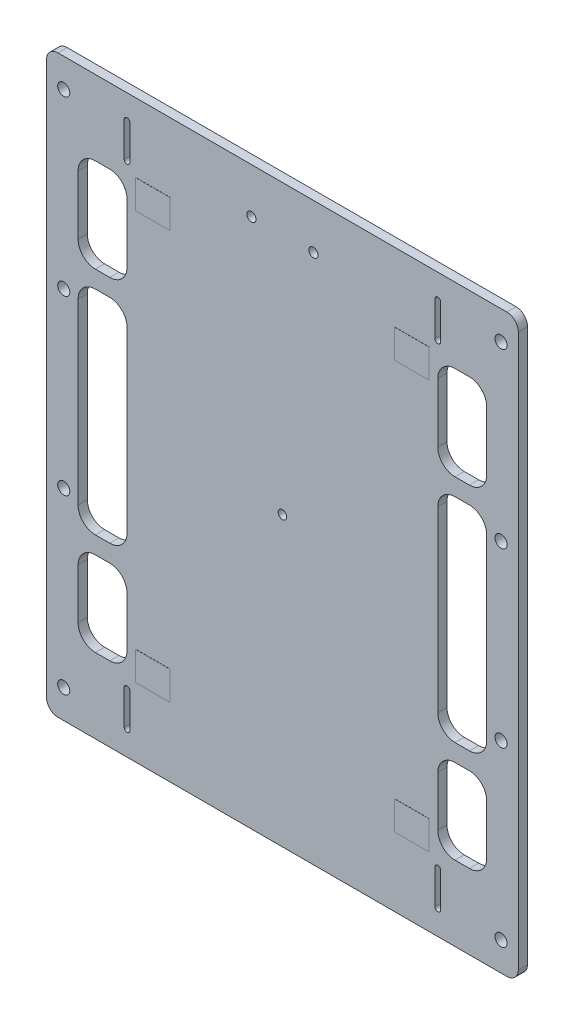
from build123d import *

# Parameters (mm, degrees)
BOARDOUTLINE_DEPTH          = 1.6
SKETCH2_R                   = 0.75
SKETCH2_R_2                 = 0.8
COMPONENTHOLES_DEPTH        = 65.680445267
SOLARCELLCONTACTHOLES_DEPTH = 1.6
WINDOWS_1SIDE_DEPTH         = 65.680445267
SKETCH5_W                   = 6
SKETCH5_H                   = 5
CONTACTPADS_DEPTH           = 0.02
M2_CLEARANCE_HOLE1_D        = 2.1


with BuildPart() as part:
    # Sketch1 → boardOutline (new body)
    with BuildSketch(Plane.XY):
        with BuildLine():
            Line((-39, -50), (39, -50))
            ThreePointArc((39, -50), (40.414213562, -49.414213562), (41, -48))
            Line((41, -48), (41, 48))
            ThreePointArc((41, 48), (40.414213562, 49.414213562), (39, 50))
            Line((39, 50), (-39, 50))
            ThreePointArc((-39, 50), (-40.414213562, 49.414213562), (-41, 48))
            Line((-41, 48), (-41, -48))
            ThreePointArc((-41, -48), (-40.414213562, -49.414213562), (-39, -50))
        make_face()
    extrude(amount=BOARDOUTLINE_DEPTH)

    # Sketch2 → componentHoles (cut, through all)
    with BuildSketch(Plane.XY.offset(1.6)):
        Circle(SKETCH2_R)
        with Locations((-5.38, 42.15)):
            Circle(SKETCH2_R_2)
        with Locations((5.39, 42.15)):
            Circle(SKETCH2_R_2)
    extrude(amount=-COMPONENTHOLES_DEPTH, mode=Mode.SUBTRACT)

    # Sketch4 → solarCellContactHoles (cut)
    with BuildSketch(Plane.XY.offset(1.6)):
        with BuildLine():
            Line((-27.5, 39.75), (-27.5, 45.75))
            ThreePointArc((-27.5, 45.75), (-27, 46.25), (-26.5, 45.75))
            Line((-26.5, 45.75), (-26.5, 39.75))
            ThreePointArc((-26.5, 39.75), (-27, 39.25), (-27.5, 39.75))
        make_face()
        with BuildLine():
            Line((26.5, 39.75), (26.5, 45.75))
            ThreePointArc((26.5, 45.75), (27, 46.25), (27.5, 45.75))
            Line((27.5, 45.75), (27.5, 39.75))
            ThreePointArc((27.5, 39.75), (27, 39.25), (26.5, 39.75))
        make_face()
        with BuildLine():
            Line((26.5, -45.75), (26.5, -39.75))
            ThreePointArc((26.5, -39.75), (27, -39.25), (27.5, -39.75))
            Line((27.5, -39.75), (27.5, -45.75))
            ThreePointArc((27.5, -45.75), (27, -46.25), (26.5, -45.75))
        make_face()
        with BuildLine():
            Line((-27.5, -45.75), (-27.5, -39.75))
            ThreePointArc((-27.5, -39.75), (-27, -39.25), (-26.5, -39.75))
            Line((-26.5, -39.75), (-26.5, -45.75))
            ThreePointArc((-26.5, -45.75), (-27, -46.25), (-27.5, -45.75))
        make_face()
    extrude(amount=-SOLARCELLCONTACTHOLES_DEPTH, mode=Mode.SUBTRACT)

    # Sketch3 → windows_1side (cut, through all)
    with BuildSketch(Plane.XY.offset(1.6)):
        with BuildLine():
            Line((-32.5, 37), (-30, 37))
            ThreePointArc((-30, 37), (-27.878679656, 36.121320344), (-27, 34))
            Line((-27, 34), (-27, 23.7))
            ThreePointArc((-27, 23.7), (-27.878679656, 21.578679656), (-30, 20.7))
            Line((-30, 20.7), (-32.5, 20.7))
            ThreePointArc((-32.5, 20.7), (-34.621320344, 21.578679656), (-35.5, 23.7))
            Line((-35.5, 23.7), (-35.5, 34))
            ThreePointArc((-35.5, 34), (-34.621320344, 36.121320344), (-32.5, 37))
        make_face()
        with BuildLine():
            Line((-30, -22.3), (-32.5, -22.3))
            ThreePointArc((-32.5, -22.3), (-34.621320344, -23.178679656), (-35.5, -25.3))
            Line((-35.5, -25.3), (-35.5, -34))
            ThreePointArc((-35.5, -34), (-34.621320344, -36.121320344), (-32.5, -37))
            Line((-32.5, -37), (-30, -37))
            ThreePointArc((-30, -37), (-27.878679656, -36.121320344), (-27, -34))
            Line((-27, -34), (-27, -25.3))
            ThreePointArc((-27, -25.3), (-27.878679656, -23.178679656), (-30, -22.3))
        make_face()
        with BuildLine():
            Line((-30, -19.3), (-32.5, -19.3))
            ThreePointArc((-32.5, -19.3), (-34.621320344, -18.421320344), (-35.5, -16.3))
            Line((-35.5, -16.3), (-35.5, 14.7))
            ThreePointArc((-35.5, 14.7), (-34.621320344, 16.821320344), (-32.5, 17.7))
            Line((-32.5, 17.7), (-30, 17.7))
            ThreePointArc((-30, 17.7), (-27.878679656, 16.821320344), (-27, 14.7))
            Line((-27, 14.7), (-27, -16.3))
            ThreePointArc((-27, -16.3), (-27.878679656, -18.421320344), (-30, -19.3))
        make_face()
    windows_1side = extrude(amount=-WINDOWS_1SIDE_DEPTH, mode=Mode.SUBTRACT)

    # Sketch5 → contactPads (add)
    with BuildSketch(Plane.XY.offset(1.6)):
        with Locations((-22.5, 35.5)):
            Rectangle(SKETCH5_W, SKETCH5_H)
        with Locations((22.5, 35.5)):
            Rectangle(SKETCH5_W, SKETCH5_H)
        with Locations((22.5, -35.5)):
            Rectangle(SKETCH5_W, SKETCH5_H)
        with Locations((-22.5, -35.5)):
            Rectangle(SKETCH5_W, SKETCH5_H)
    extrude(amount=CONTACTPADS_DEPTH)

    # M2 Clearance Hole1 (through all)
    with Locations(Plane(origin=(0, 0, 0), x_dir=(-1, 0, 0), z_dir=(0, 0, -1))):
        with Locations((38, 45), (38, -15), (38, -45), (38, 15)):
            m2_clearance_hole1 = Hole(M2_CLEARANCE_HOLE1_D / 2)

    # Mirror1: windows_1side, M2 Clearance Hole1 across plane
    add(windows_1side.mirror(Plane(origin=(0, 0, 0), x_dir=(0, 0, 1), z_dir=(1, 0, 0))), mode=Mode.SUBTRACT)
    add(m2_clearance_hole1.mirror(Plane(origin=(0, 0, 0), x_dir=(0, 0, 1), z_dir=(1, 0, 0))), mode=Mode.SUBTRACT)


solid = part.part
